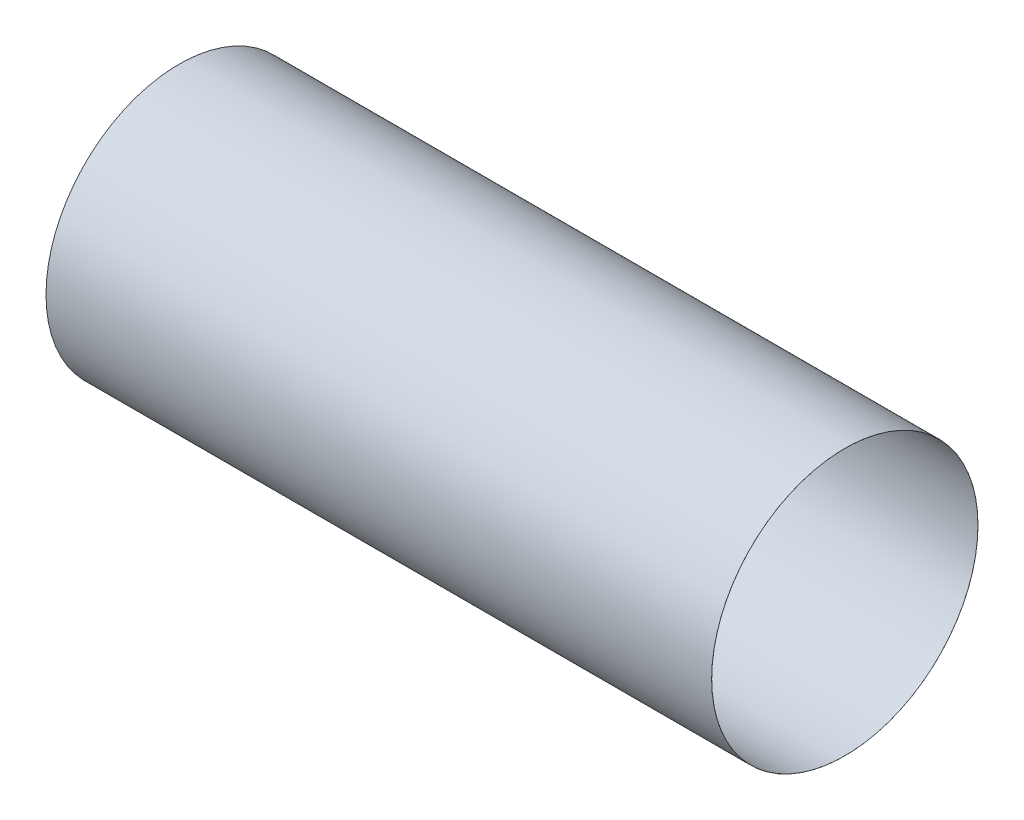
from build123d import *

# Parameters (mm, degrees)
SKETCH2_R           = 60.9854
SKETCH2_R_2         = 60.96
EXTRUDE_THIN1_DEPTH = 304.8


with BuildPart() as part:
    # Sketch2 → Extrude-Thin1 (new body)
    with BuildSketch(Plane(origin=(0, 0, 0), x_dir=(0, 0, -1), z_dir=(1, 0, 0))):
        Circle(SKETCH2_R)
        Circle(SKETCH2_R_2, mode=Mode.SUBTRACT)
    extrude(amount=EXTRUDE_THIN1_DEPTH)


solid = part.part
